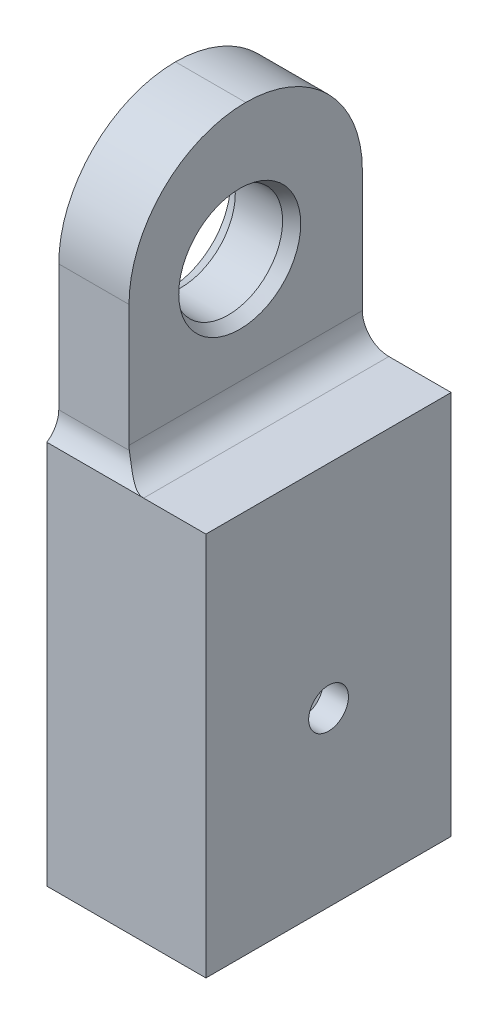
from build123d import *
from OCP.BRepFilletAPI import BRepFilletAPI_MakeChamfer

# Parameters (mm, degrees)
SKETCH1_W           = 12
SKETCH1_H           = 18.5
BOSS_EXTRUDE1_DEPTH = 29
SKETCH2_W           = 8.2
SKETCH2_H           = 15.2
CUT_EXTRUDE1_DEPTH  = 23
SKETCH4_W           = 5.3
SKETCH4_H           = 17.6
BOSS_EXTRUDE2_DEPTH = 20
CUT_EXTRUDE2_REACH  = 52.314
SKETCH5_R           = 4.1
FILLET1_R           = 8.8
SKETCH6_R           = 1.5
CUT_EXTRUDE3_DEPTH  = 52.289009544
CHAMFER1_SIZE       = 0.5
CHAMFER1_SIZE2      = 0.866025404
FILLET6_R           = 2


# Some blends are built 0.0001 mm under size
with BuildPart() as part:
    # Sketch1 → Boss-Extrude1 (new body)
    with BuildSketch(Plane(origin=(0, 0, 0), x_dir=(1, 0, 0), z_dir=(0, 1, 0))):
        Rectangle(SKETCH1_W, SKETCH1_H)
    extrude(amount=BOSS_EXTRUDE1_DEPTH)

    # Sketch2 → Cut-Extrude1 (cut)
    with BuildSketch(Plane.XZ):
        Rectangle(SKETCH2_W, SKETCH2_H)
    extrude(amount=-CUT_EXTRUDE1_DEPTH, mode=Mode.SUBTRACT)

    # Sketch4 → Boss-Extrude2 (add)
    with BuildSketch(Plane(origin=(0, 29, 0), x_dir=(1, 0, 0), z_dir=(0, 1, 0))):
        with Locations((-3.35, 0.45)):
            Rectangle(SKETCH4_W, SKETCH4_H)
    extrude(amount=BOSS_EXTRUDE2_DEPTH)

    # Sketch5 → Cut-Extrude2 (cut, up to next)
    with BuildSketch(Plane(origin=(-0.7, 0, 0), x_dir=(0, 0, -1), z_dir=(1, 0, 0)), mode=Mode.PRIVATE) as cut_extrude2_sk1:
        with Locations((0, 39)):
            Circle(SKETCH5_R)
    cut_extrude2_tool1 = extrude(cut_extrude2_sk1.sketch, amount=-CUT_EXTRUDE2_REACH, mode=Mode.PRIVATE) & part.part
    add(cut_extrude2_tool1.solids().sort_by_distance((-0.7, 39, 0))[0], mode=Mode.SUBTRACT)

    # Fillet1
    fillet1_edges = [part.edges().sort_by_distance(p)[0] for p in [
        (-3.35, 49, -9.25),
        (-3.35, 49, 8.35),
    ]]
    fillet(fillet1_edges, radius=FILLET1_R - 0.0001)  # a hair under: the kernel refuses the full size

    # Sketch6 → Cut-Extrude3 (cut, through all)
    with BuildSketch(Plane(origin=(6, 0, 0), x_dir=(0, 0, -1), z_dir=(1, 0, 0))):
        with Locations((0, 13)):
            Circle(SKETCH6_R)
    extrude(amount=-CUT_EXTRUDE3_DEPTH, mode=Mode.SUBTRACT)

    # Chamfer1: one chamfer whose edges measure the first distance from different faces: ONE call of the kernel's chamfer builder (chamfer() names one face for all edges)
    chamfer1_edges_1 = [part.edges().sort_by_distance(p)[0] for p in [
        (-0.7, 39, 4.1),
    ]]
    chamfer1_side_1 = [part.faces().sort_by_distance(p)[0] for p in [
        (-0.7, 34.60005, 8.083586787),
    ]]
    chamfer1_edges_2 = [part.edges().sort_by_distance(p)[0] for p in [
        (-6, 39, 4.1),
    ]]
    chamfer1_side_2 = [part.faces().sort_by_distance(p)[0] for p in [
        (-6, 22.369672876, -0.180344797),
    ]]
    chamfer1 = BRepFilletAPI_MakeChamfer(part.part.solid().wrapped)
    for e in chamfer1_edges_1:
        chamfer1.Add(CHAMFER1_SIZE, CHAMFER1_SIZE2, e.wrapped, chamfer1_side_1[0].wrapped)  # the first distance lies on this face
    for e in chamfer1_edges_2:
        chamfer1.Add(CHAMFER1_SIZE, CHAMFER1_SIZE2, e.wrapped, chamfer1_side_2[0].wrapped)  # the first distance lies on this face
    add(Compound.cast(chamfer1.Shape()), mode=Mode.REPLACE)

    # Fillet6
    # the kernel refuses this fillet: 2 mm, written as the material it adds along each edge
    with BuildSketch(Plane(origin=(-0.7, 29, 8.35), x_dir=(1, 0, 0), z_dir=(0, 0, -1))) as fillet6_piece_1:
        with BuildLine():
            CenterArc((FILLET6_R, -FILLET6_R), FILLET6_R, 90, 90)
            Line((0, -FILLET6_R), (-FILLET6_R * 0.02, -FILLET6_R))
            Line((-FILLET6_R * 0.02, -FILLET6_R), (-FILLET6_R * 0.02, FILLET6_R * 0.02))
            Line((-FILLET6_R * 0.02, FILLET6_R * 0.02), (FILLET6_R, FILLET6_R * 0.02))
            Line((FILLET6_R, FILLET6_R * 0.02), (FILLET6_R, 0))
        make_face()
    extrude(amount=17.6)
    with BuildSketch(Plane(origin=(-6, 29, 8.35), x_dir=(0, 1.5316143415257847e-12, 1.0), z_dir=(1, 0, 0))) as fillet6_piece_2:
        with BuildLine():
            CenterArc((2, -1.670329309), FILLET6_R, 123.367012969, 56.632987031)
            Line((0, -1.670329309), (-0.04, -1.670329309))
            Line((-0.04, -1.670329309), (-0.04, 0))
            Line((-0.04, 0), (0, 0.04))
            ThreePointArc((0, 0.04), (0.45, 0.04), (0.878, 0.033406586))
            Line((0.878, 0.033406586), (0.9, 0))
        make_face()
    extrude(amount=5.3)
    with BuildSketch(Plane(origin=(-6, 29, 8.35), x_dir=(0, 1.5316143415257847e-12, 1.0), z_dir=(1, 0, 0))) as fillet6_piece_3a_section:
        with BuildLine():
            CenterArc((2, -1.670329309), FILLET6_R, 123.367012969, 56.632987031)
            Line((0, -1.670329309), (-0.04, -1.670329309))
            Line((-0.04, -1.670329309), (-0.04, 0))
            Line((-0.04, 0), (0, 0.04))
            ThreePointArc((0, 0.04), (0.45, 0.04), (0.878, 0.033406586))
            Line((0.878, 0.033406586), (0.9, 0))
        make_face()
    fillet6_piece_3a = extrude(amount=9.475823272, mode=Mode.PRIVATE)
    fillet6_piece_3a = split(fillet6_piece_3a, bisect_by=Plane(origin=(-0.7, 29.423174299, 8.582221018), z_dir=(1, 0, 0)), keep=Keep.TOP, mode=Mode.PRIVATE)
    with BuildSketch(Plane(origin=(-0.7, 29, 13.35), x_dir=(1, 0, 0), z_dir=(0, 0, -1))) as fillet6_piece_3b_section:
        with BuildLine():
            CenterArc((FILLET6_R, -FILLET6_R), FILLET6_R, 90, 90)
            Line((0, -FILLET6_R), (-FILLET6_R * 0.02, -FILLET6_R))
            Line((-FILLET6_R * 0.02, -FILLET6_R), (-FILLET6_R * 0.02, FILLET6_R * 0.02))
            Line((-FILLET6_R * 0.02, FILLET6_R * 0.02), (FILLET6_R, FILLET6_R * 0.02))
            Line((FILLET6_R, FILLET6_R * 0.02), (FILLET6_R, 0))
        make_face()
    fillet6_piece_3b = extrude(amount=22.6, mode=Mode.PRIVATE)
    fillet6_piece_3b = split(fillet6_piece_3b, bisect_by=Plane(origin=(-0.247209771, 29.452790229, 9.25), z_dir=(0, 0, -1)), keep=Keep.TOP, mode=Mode.PRIVATE)
    fillet6_piece_3b = split(fillet6_piece_3b, bisect_by=Plane(origin=(-0.247209771, 29.452790229, 8.35), z_dir=(0, 0, 1)), keep=Keep.TOP, mode=Mode.PRIVATE)
    fillet6_piece_3 = fillet6_piece_3a & fillet6_piece_3b
    add(fillet6_piece_3)


solid = part.part
